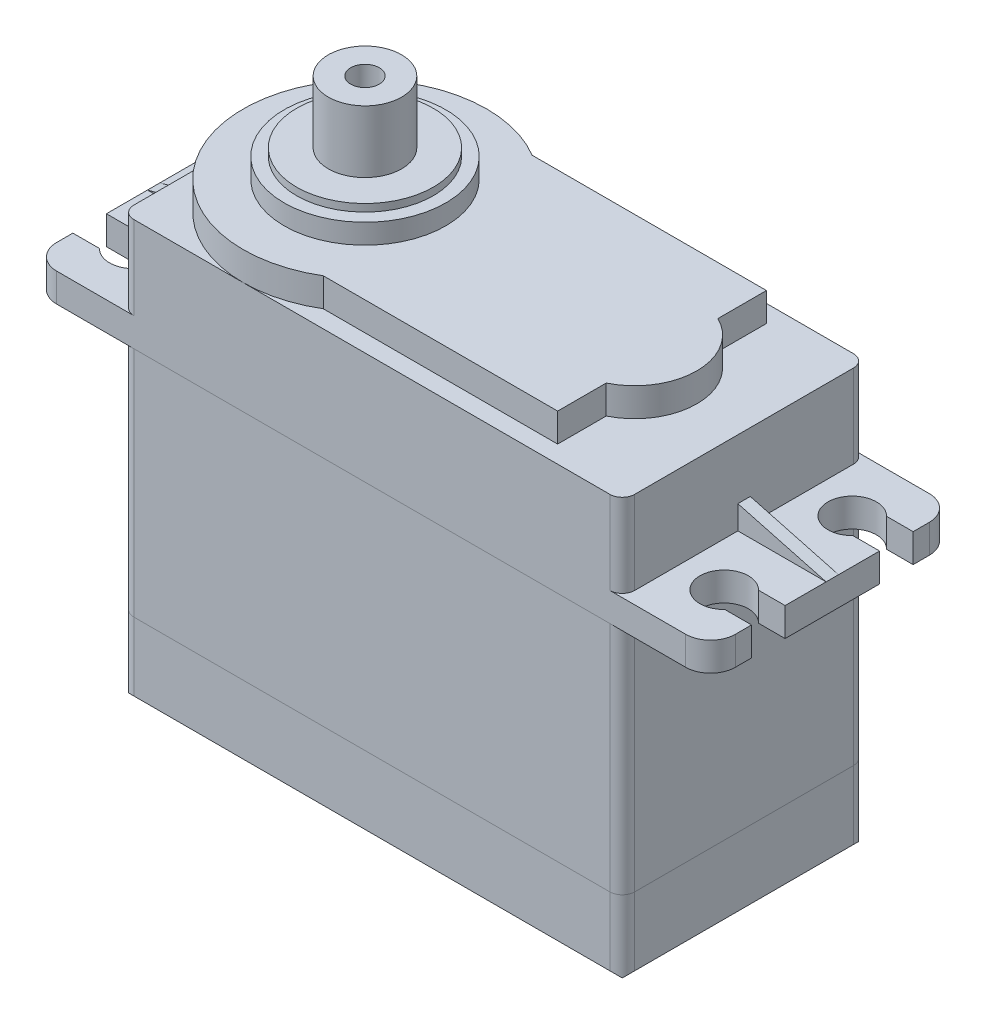
from build123d import *

# Parameters (mm, degrees)
SALIENTE_EXTRUIR1_DEPTH = 19.6
CROQUIS1_3_W            = 40.3
CROQUIS1_3_H            = 18.7
SALIENTE_EXTRUIR2_DEPTH = 19.6
CROQUIS1_4_W            = 40.3
CROQUIS1_4_H            = 7.3
SALIENTE_EXTRUIR3_DEPTH = 19.6
REDONDEO1_R             = 2
REDONDEO2_R             = 1
REDONDEO3_R             = 1
REDONDEO4_R             = 1
CHAFL_N1_SIZE           = 2
CHAFL_N2_SIZE           = 1.8
CHAFL_N3_SIZE           = 1.8
CROQUIS2_R              = 6.5
SALIENTE_EXTRUIR4_DEPTH = 2.3
CROQUIS2_3_R            = 6.5
SALIENTE_EXTRUIR5_DEPTH = 3.9
CROQUIS2_5_R            = 5.5
SALIENTE_EXTRUIR6_DEPTH = 4.5
CROQUIS2_6_R            = 2.95
CROQUIS2_6_R_2          = 1.15
SALIENTE_EXTRUIR7_DEPTH = 9.5
CORTAR_EXTRUIR1_DEPTH   = 2.3
NERVIO21_REACH          = 61.731
CROQUIS4_WALL_W         = 128.81195782
CROQUIS4_WALL_H         = 1
NERVIO24_REACH          = 61.731
CROQUIS5_WALL_W         = 128.908603566
CROQUIS5_WALL_H         = 1


with BuildPart() as part:
    # Croquis1 → Saliente-Extruir1 (new body)
    with BuildSketch(Plane.XY):
        Polygon((40.3, -9), (0, -9), (-7.2, -9), (-7.2, -6.7), (0, -6.7), (0, 0), (40.3, 0), (40.3, -6.7), (47.4, -6.7), (47.4, -9), align=None)
    extrude(amount=-SALIENTE_EXTRUIR1_DEPTH)

    # Redondeo1
    redondeo1_edges = [part.edges().sort_by_distance(p)[0] for p in [
        (-7.2, -7.85, 0),
        (47.4, -7.85, -19.6),
        (47.4, -7.85, 0),
        (-7.2, -7.85, -19.6),
    ]]
    fillet(redondeo1_edges, radius=REDONDEO1_R)

    # Redondeo4
    redondeo4_edges = [part.edges().sort_by_distance(p)[0] for p in [
        (0, -3.35, 0),
        (40.3, -3.35, 0),
        (40.3, -3.35, -19.6),
        (0, -3.35, -19.6),
    ]]
    fillet(redondeo4_edges, radius=REDONDEO4_R)

    # Croquis2 → Saliente-Extruir4 (add)
    with BuildSketch(Plane(origin=(0, 0, 0), x_dir=(1, 0, 0), z_dir=(0, 1, 0))):
        with BuildLine():
            Line((33.7, 5.310011136), (33.7, 1.4))
            Line((33.7, 1.4), (14.847771786, 1.4))
            ThreePointArc((14.847771786, 1.4), (0, 9.8), (14.847771786, 18.2))
            Line((14.847771786, 18.2), (33.7, 18.2))
            Line((33.7, 18.2), (33.7, 14.289988864))
            ThreePointArc((33.7, 14.289988864), (36.5, 9.8), (33.7, 5.310011136))
        make_face()
        with Locations(Location((9.8, 9.8, 0), (0, 0, 270))):
            Circle(CROQUIS2_R, mode=Mode.SUBTRACT)
    extrude(amount=SALIENTE_EXTRUIR4_DEPTH)

    # Croquis2<3> → Saliente-Extruir5 (add)
    with BuildSketch(Plane(origin=(0, 0, 0), x_dir=(1, 0, 0), z_dir=(0, 1, 0))):
        with Locations(Location((9.8, 9.8, 0), (0, 0, 270))):
            Circle(CROQUIS2_3_R)
    extrude(amount=SALIENTE_EXTRUIR5_DEPTH)

    # Croquis2<5> → Saliente-Extruir6 (add)
    with BuildSketch(Plane(origin=(0, 0, 0), x_dir=(1, 0, 0), z_dir=(0, 1, 0))):
        with Locations(Location((9.8, 9.8, 0), (0, 0, 270))):
            Circle(CROQUIS2_5_R)
    extrude(amount=SALIENTE_EXTRUIR6_DEPTH)

    # Croquis2<6> → Saliente-Extruir7 (add)
    with BuildSketch(Plane(origin=(0, 0, 0), x_dir=(1, 0, 0), z_dir=(0, 1, 0))):
        with Locations(Location((9.8, 9.8, 0), (0, 0, 270))):
            Circle(CROQUIS2_6_R)
        with Locations(Location((9.8, 9.8, 0), (0, 0, 270))):
            Circle(CROQUIS2_6_R_2, mode=Mode.SUBTRACT)
    extrude(amount=SALIENTE_EXTRUIR7_DEPTH)

    # Croquis3 → Cortar-Extruir1 (cut)
    with BuildSketch(Plane(origin=(0, -6.7, 0), x_dir=(1, 0, 0), z_dir=(0, 1, 0))):
        with BuildLine():
            Line((47.4, 16.3), (47.4, 13.6))
            Line((47.4, 13.6), (45.257124728, 13.6))
            ThreePointArc((45.257124728, 13.6), (41.9, 14.95), (45.257124728, 16.3))
            Line((45.257124728, 16.3), (47.4, 16.3))
        make_face()
        with BuildLine():
            Line((47.4, 3.3), (45.257124728, 3.3))
            ThreePointArc((45.257124728, 3.3), (41.9, 4.65), (45.257124728, 6))
            Line((45.257124728, 6), (47.4, 6))
            Line((47.4, 6), (47.4, 3.3))
        make_face()
        with BuildLine():
            Line((-7.2, 3.3), (-7.2, 6))
            Line((-7.2, 6), (-5.057124728, 6))
            ThreePointArc((-5.057124728, 6), (-1.7, 4.65), (-5.057124728, 3.3))
            Line((-5.057124728, 3.3), (-7.2, 3.3))
        make_face()
        with BuildLine():
            Line((-7.2, 16.3), (-5.057124728, 16.3))
            ThreePointArc((-5.057124728, 16.3), (-1.7, 14.95), (-5.057124728, 13.6))
            Line((-5.057124728, 13.6), (-7.2, 13.6))
            Line((-7.2, 13.6), (-7.2, 16.3))
        make_face()
    extrude(amount=-CORTAR_EXTRUIR1_DEPTH, mode=Mode.SUBTRACT)

    # Croquis4 wall → Nervio21 (add, up to next)
    with BuildSketch(Plane(origin=(43.85, -5.75, -9.8), x_dir=(-0.966008746817, 0.258509382951, 0), z_dir=(-0.258509382951, -0.966008746817, 0)), mode=Mode.PRIVATE) as nervio21_sk1:
        Rectangle(CROQUIS4_WALL_W, CROQUIS4_WALL_H)
    nervio21_tool1 = extrude(nervio21_sk1.sketch, amount=NERVIO21_REACH, mode=Mode.PRIVATE) - part.part
    add(nervio21_tool1.solids().sort_by_distance((43.85, -5.75, -9.8))[0])

    # Croquis5 wall → Nervio24 (add, up to next)
    with BuildSketch(Plane(origin=(-3.6, -5.75, -9.8), x_dir=(0.966900358349, 0.255154261231, 0), z_dir=(-0.255154261231, 0.966900358349, 0)), mode=Mode.PRIVATE) as nervio24_sk1:
        Rectangle(CROQUIS5_WALL_W, CROQUIS5_WALL_H)
    nervio24_tool1 = extrude(nervio24_sk1.sketch, amount=-NERVIO24_REACH, mode=Mode.PRIVATE) - part.part
    add(nervio24_tool1.solids().sort_by_distance((-3.6, -5.75, -9.8))[0])


with BuildPart() as body_2:
    # Croquis1<3> → Saliente-Extruir2 (new body)
    with BuildSketch(Plane.XY):
        with Locations((20.15, -18.35)):
            Rectangle(CROQUIS1_3_W, CROQUIS1_3_H)
    extrude(amount=-SALIENTE_EXTRUIR2_DEPTH)

    # Redondeo2
    redondeo2_edges = [body_2.edges().sort_by_distance(p)[0] for p in [
        (0, -18.35, -19.6),
        (0, -18.35, 0),
        (40.3, -18.35, 0),
        (40.3, -18.35, -19.6),
    ]]
    fillet(redondeo2_edges, radius=REDONDEO2_R)


with BuildPart() as body_3:
    # Croquis1<4> → Saliente-Extruir3 (new body)
    with BuildSketch(Plane.XY):
        with Locations((20.15, -31.35)):
            Rectangle(CROQUIS1_4_W, CROQUIS1_4_H)
    extrude(amount=-SALIENTE_EXTRUIR3_DEPTH)

    # Redondeo3
    redondeo3_edges = [body_3.edges().sort_by_distance(p)[0] for p in [
        (0, -31.35, -19.6),
        (40.3, -31.35, -19.6),
        (0, -31.35, 0),
        (40.3, -31.35, 0),
    ]]
    fillet(redondeo3_edges, radius=REDONDEO3_R)

    # Chaflán1
    # the kernel refuses this chamfer: 2 mm, written as the material it takes off along each edge
    with BuildSketch(Plane(origin=(-4.143365976, -35, -19.6), x_dir=(0, -0.027495876610585647, 0.9996219169112968), z_dir=(1, 0, 0))) as chafl_n1_piece_1:
        Polygon((CHAFL_N1_SIZE * 0.999621916911, -CHAFL_N1_SIZE * 0.0274958766106), (-CHAFL_N1_SIZE * 0.0274958766106, -CHAFL_N1_SIZE * 0.999621916911), (0, 0), align=None)
    extrude(amount=48.586731952, mode=Mode.SUBTRACT)

    # Chaflán2
    # the kernel refuses this chamfer: 1.8 mm, written as the material it takes off along each edge
    with BuildSketch(Plane(origin=(0, -35, 3.629029378), x_dir=(-0.02749587661058661, 0.9996219169112966, 0), z_dir=(0, 0, -1))) as chafl_n2_piece_1:
        Polygon((CHAFL_N2_SIZE * 0.999621916911, CHAFL_N2_SIZE * 0.0274958766106), (-CHAFL_N2_SIZE * 0.0274958766106, CHAFL_N2_SIZE * 0.999621916911), (0, 0), align=None)
    extrude(amount=25.858058757, mode=Mode.SUBTRACT)

    # Chaflán3
    # the kernel refuses this chamfer: 1.8 mm, written as the material it takes off along each edge
    with BuildSketch(Plane(origin=(40.3, -35, 3.629029378), x_dir=(-0.9996219169112969, -0.02749587661058457, 0), z_dir=(0, 0, -1))) as chafl_n3_piece_1:
        Polygon((CHAFL_N3_SIZE * 0.999621916911, CHAFL_N3_SIZE * 0.0274958766106), (-CHAFL_N3_SIZE * 0.0274958766106, CHAFL_N3_SIZE * 0.999621916911), (0, 0), align=None)
    extrude(amount=25.858058757, mode=Mode.SUBTRACT)
    with BuildSketch(Plane(origin=(-2.829029378, -35, 0), x_dir=(0, 0.9996219169112966, 0.02749587661058649), z_dir=(1, 0, 0))) as chafl_n3_piece_2:
        Polygon((CHAFL_N3_SIZE * 0.999621916911, -CHAFL_N3_SIZE * 0.0274958766106), (-CHAFL_N3_SIZE * 0.0274958766106, -CHAFL_N3_SIZE * 0.999621916911), (0, 0), align=None)
    extrude(amount=46.758058757, mode=Mode.SUBTRACT)


solid = Compound([part.part, body_2.part, body_3.part])
